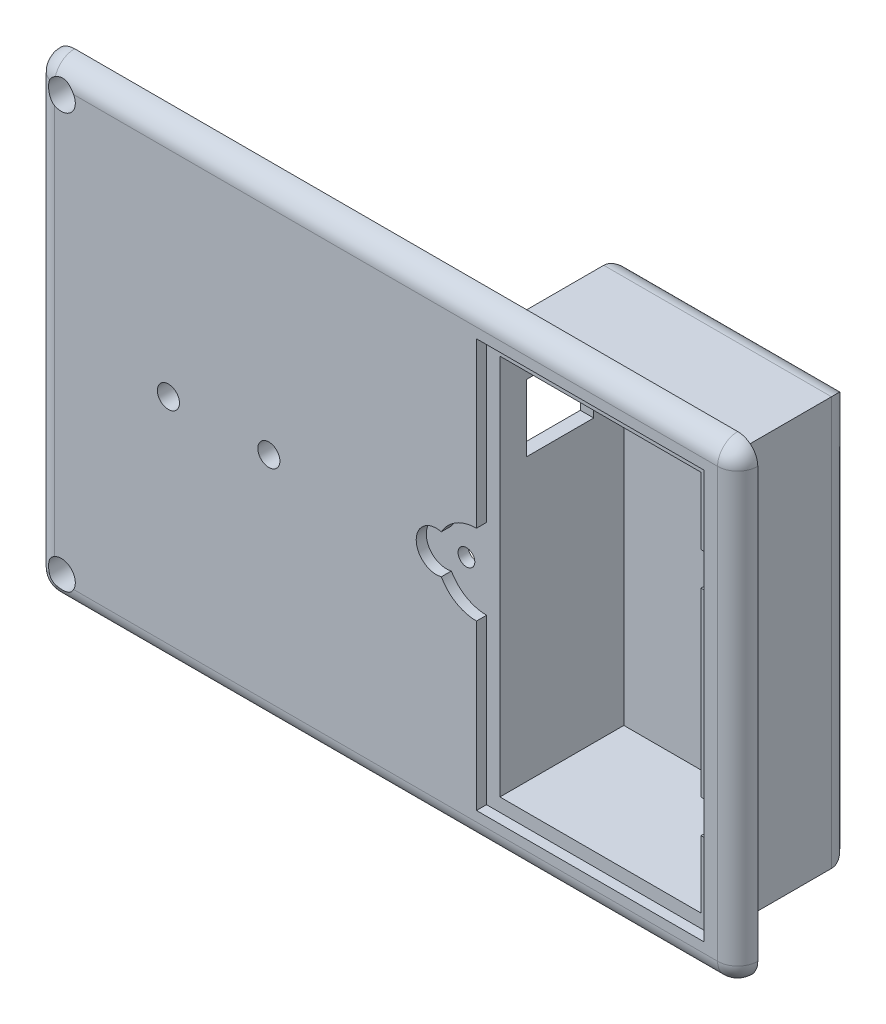
from build123d import *

# Parameters (mm, degrees)
SKETCH1_W                   = 105
SKETCH1_H                   = 70
BOSS_EXTRUDE1_DEPTH         = 3
FILLET4_R                   = 3
FILLET5_R                   = 3
FILLET6_R                   = 3
M5X0_8_TAPPED_HOLE2_D       = 4.2
SKETCH16_6_W                = 34
SKETCH16_6_H                = 61
SKETCH16_6_W_2              = 30
SKETCH16_6_H_2              = 57
BOSS_EXTRUDE3_DEPTH         = 20
CUT_EXTRUDE8_REACH          = 129.334
SKETCH21_W                  = 30
SKETCH21_H                  = 57
SKETCH20_W                  = 34
SKETCH20_H                  = 61
BOSS_EXTRUDE4_DEPTH         = 2
SKETCH22_W                  = 34
SKETCH22_H                  = 61
CUT_EXTRUDE9_DEPTH          = 1.5
FILLET8_R                   = 3
SKETCH26_R                  = 6
CUT_EXTRUDE10_DEPTH         = 1.5
M3_TAPPED_HOLE1_D           = 2.5
M3_TAPPED_HOLE1_DEPTH       = 7.5
M3_TAPPED_HOLE1_TIP         = 0.751075774
SKETCH33_W                  = 1.5
SKETCH33_H                  = 5
CUT_EXTRUDE11_DEPTH         = 3
M3_TAPPED_HOLE2_D           = 2.5
M3_TAPPED_HOLE2_DEPTH       = 7.5
M3_TAPPED_HOLE2_TIP         = 0.751075774
M3_TAPPED_HOLE3_D           = 2.5
M3_TAPPED_HOLE3_DEPTH       = 7.5
M3_TAPPED_HOLE3_TIP         = 0.751075774
CUT_EXTRUDE12_REACH         = 101.423
SKETCH37_W                  = 10
SKETCH37_H                  = 10
SKETCH39_R                  = 3
CUT_EXTRUDE13_DEPTH         = 1.5
TAP_DRILL_FOR_M4X0_7_TAP2_D = 3.3


with BuildPart() as part:
    # Sketch1 → Boss-Extrude1 (new body)
    with BuildSketch(Plane.XY):
        with Locations((52.5, 35)):
            Rectangle(SKETCH1_W, SKETCH1_H)
    extrude(amount=BOSS_EXTRUDE1_DEPTH)

    # Fillet4
    fillet4_edges = [part.edges().sort_by_distance(p)[0] for p in [
        (105, 0, 1.5),
        (105, 70, 1.5),
    ]]
    fillet(fillet4_edges, radius=FILLET4_R)

    # Fillet5
    fillet5_edges = [part.edges().sort_by_distance(p)[0] for p in [
        (51, 70, 3),
        (105, 35, 3),
        (51, 0, 3),
        (104.121320344, 69.121320344, 3),
        (104.121320344, 0.878679656, 3),
    ]]
    fillet(fillet5_edges, radius=FILLET5_R - 0.0001)  # a hair under: the kernel refuses the full size

    # Fillet6
    fillet6_edges = [part.edges().sort_by_distance(p)[0] for p in [
        (0, 35, 3),
        (0, 0.878650367, 2.121349633),
        (0, 69.121349633, 2.121349633),
    ]]
    fillet(fillet6_edges, radius=FILLET6_R - 0.0001)  # a hair under: the kernel refuses the full size

    # M5x0.8 Tapped Hole2 (through all)
    with Locations(Plane(origin=(4, 66, 3), x_dir=(1, 0, 0), z_dir=(0, 0, 1))):
        with Locations((0, 0), (0, -62)):
            Hole(M5X0_8_TAPPED_HOLE2_D / 2)

    # Sketch16<6> → Boss-Extrude3 (add)
    with BuildSketch(Plane.XY.offset(3)):
        with Locations((83, 35)):
            Rectangle(SKETCH16_6_W, SKETCH16_6_H)
        with Locations((83, 35)):
            Rectangle(SKETCH16_6_W_2, SKETCH16_6_H_2, mode=Mode.SUBTRACT)
    extrude(amount=-BOSS_EXTRUDE3_DEPTH)

    # Sketch21 → Cut-Extrude8 (cut, up to next)
    with BuildSketch(Plane(origin=(0, 0, 0), x_dir=(-1, 0, 0), z_dir=(0, 0, -1)), mode=Mode.PRIVATE) as cut_extrude8_sk1:
        with Locations((-83, 35)):
            Rectangle(SKETCH21_W, SKETCH21_H)
    cut_extrude8_tool1 = extrude(cut_extrude8_sk1.sketch, amount=-CUT_EXTRUDE8_REACH, mode=Mode.PRIVATE) & part.part
    add(cut_extrude8_tool1.solids().sort_by_distance((83, 35, 0))[0], mode=Mode.SUBTRACT)

    # Sketch20 → Boss-Extrude4 (add)
    with BuildSketch(Plane(origin=(0, 0, -17), x_dir=(-1, 0, 0), z_dir=(0, 0, -1))):
        with Locations((-83, 35)):
            Rectangle(SKETCH20_W, SKETCH20_H)
    extrude(amount=BOSS_EXTRUDE4_DEPTH)

    # Sketch22 → Cut-Extrude9 (cut)
    with BuildSketch(Plane.XY.offset(3)):
        with Locations((83, 35)):
            Rectangle(SKETCH22_W, SKETCH22_H)
    extrude(amount=-CUT_EXTRUDE9_DEPTH, mode=Mode.SUBTRACT)

    # Fillet8
    fillet8_edges = [part.edges().sort_by_distance(p)[0] for p in [
        (100, 35, -19),
        (83, 4.5, -19),
        (66, 35, -19),
        (83, 65.5, -19),
    ]]
    fillet(fillet8_edges, radius=FILLET8_R)

    # Sketch26 → Cut-Extrude10 (cut)
    with BuildSketch(Plane.XY.offset(3)):
        with Locations((66, 35)):
            Circle(SKETCH26_R)
    extrude(amount=-CUT_EXTRUDE10_DEPTH, mode=Mode.SUBTRACT)

    # M3 Tapped Hole1
    with Locations(Plane(origin=(63, 35, 1.5), x_dir=(1, 0, 0), z_dir=(0, 0, 1))):
        with Locations((0, 0)):
            Hole(M3_TAPPED_HOLE1_D / 2, depth=M3_TAPPED_HOLE1_DEPTH)
            with Locations((0, 0, -(M3_TAPPED_HOLE1_DEPTH + M3_TAPPED_HOLE1_TIP / 2))):  # 118° drill point
                Cone(0, M3_TAPPED_HOLE1_D / 2, M3_TAPPED_HOLE1_TIP, mode=Mode.SUBTRACT)

    # Sketch33 → Cut-Extrude11 (cut)
    with BuildSketch(Plane.ZY.offset(-98)):
        with Locations((0.75, 51)):
            Rectangle(SKETCH33_W, SKETCH33_H)
        with Locations((0.75, 19)):
            Rectangle(SKETCH33_W, SKETCH33_H)
    extrude(amount=-CUT_EXTRUDE11_DEPTH, mode=Mode.SUBTRACT)

    # M3 Tapped Hole2
    with Locations(Plane(origin=(95.52684029, 8.597468083, -17), x_dir=(1, 0, 0), z_dir=(0, 0, 1))):
        with Locations((0, 0)):
            Hole(M3_TAPPED_HOLE2_D / 2, depth=M3_TAPPED_HOLE2_DEPTH)
            with Locations((0, 0, -(M3_TAPPED_HOLE2_DEPTH + M3_TAPPED_HOLE2_TIP / 2))):  # 118° drill point
                Cone(0, M3_TAPPED_HOLE2_D / 2, M3_TAPPED_HOLE2_TIP, mode=Mode.SUBTRACT)

    # M3 Tapped Hole3
    with Locations(Plane(origin=(95.52684029, 61.4, -17), x_dir=(1, 0, 0), z_dir=(0, 0, 1))):
        with Locations((0, 0)):
            Hole(M3_TAPPED_HOLE3_D / 2, depth=M3_TAPPED_HOLE3_DEPTH)
            with Locations((0, 0, -(M3_TAPPED_HOLE3_DEPTH + M3_TAPPED_HOLE3_TIP / 2))):  # 118° drill point
                Cone(0, M3_TAPPED_HOLE3_D / 2, M3_TAPPED_HOLE3_TIP, mode=Mode.SUBTRACT)

    # Sketch37 → Cut-Extrude12 (cut, up to next)
    with BuildSketch(Plane(origin=(68, 0, 0), x_dir=(0, 0, -1), z_dir=(1, 0, 0)), mode=Mode.PRIVATE) as cut_extrude12_sk1:
        with Locations((7.5, 53.5)):
            Rectangle(SKETCH37_W, SKETCH37_H)
    cut_extrude12_tool1 = extrude(cut_extrude12_sk1.sketch, amount=-CUT_EXTRUDE12_REACH, mode=Mode.PRIVATE) & part.part
    add(cut_extrude12_tool1.solids().sort_by_distance((68, 53.5, -7.5))[0], mode=Mode.SUBTRACT)

    # Sketch39 → Cut-Extrude13 (cut)
    with BuildSketch(Plane.XY.offset(3)):
        with Locations((60, 35)):
            Circle(SKETCH39_R)
    extrude(amount=-CUT_EXTRUDE13_DEPTH, mode=Mode.SUBTRACT)

    # Tap Drill for M4x0.7 Tap2 (through all)
    with Locations(Plane(origin=(20, 35, 3), x_dir=(1, 0, 0), z_dir=(0, 0, 1))):
        with Locations((0, 0), (15, 0)):
            Hole(TAP_DRILL_FOR_M4X0_7_TAP2_D / 2)


solid = part.part
